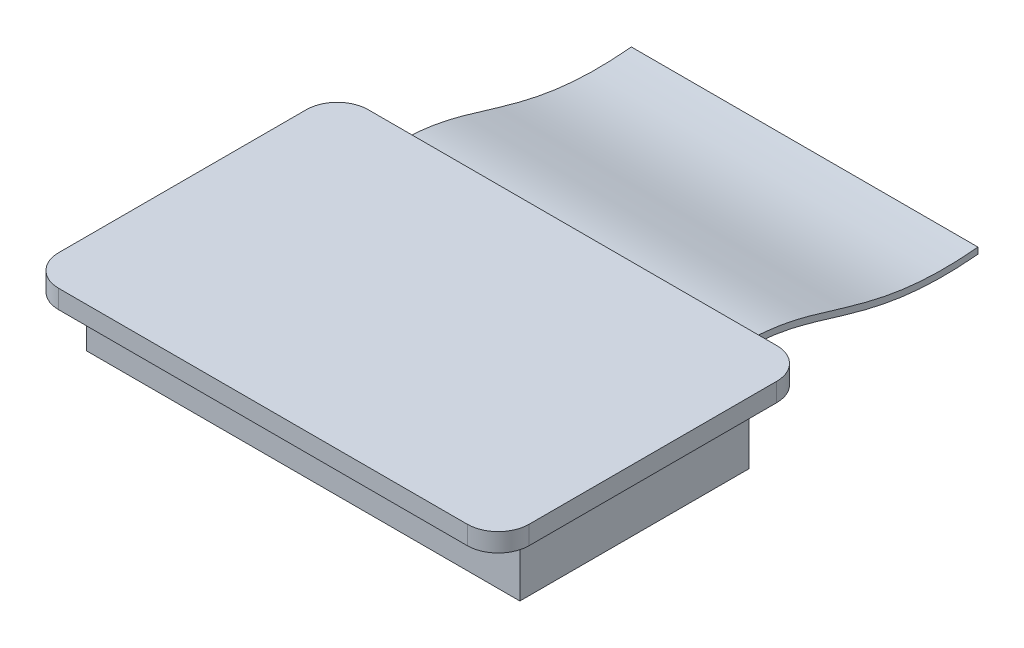
from build123d import *

# Parameters (mm, degrees)
F_3_8MM_FREE_LENGTH_START    = -2.8
F_3_8MM_FREE_LENGTH_DEPTH    = 5.6
PCB_DEPTH                    = 0.3
SKIZZE7_W                    = 3.7
SKIZZE7_H                    = 1
CONNECTOR_BOUNDARY_BOX_DEPTH = 3.5


# Read off the part's stored shape, not the designer's step: 3,8mm_free_Length
with BuildPart() as part:
    # 3,8mm_free_Length outline → 3,8mm_free_Length (new body)
    with BuildSketch(Plane.YZ.offset(F_3_8MM_FREE_LENGTH_START)):
        with BuildLine():
            add(Edge.make_bspline(
                [(0, 4), (-0.024628468, 4.256388466), (-0.038618016, 4.72259081), (0.01947153, 5.312011185), (0.129906645, 5.821389043), (0.291873769, 6.368027096), (0.477782991, 6.965975593), (0.547843022, 7.463268805), (0.547843022, 7.742133946)],
                knots=[0, 0, 0, 0, 0.14, 0.28, 0.42, 0.56, 0.78, 1, 1, 1, 1], degree=3))
            Line((0.547843022, 7.742133946), (0.448301222, 7.75169585))
            add(Edge.make_bspline(
                [(-0.1, 4), (-0.124487823, 4.260512861), (-0.138196079, 4.734963994), (-0.077568446, 5.337055167), (0.035994262, 5.856090972), (0.200282397, 6.407901627), (0.382793216, 6.999767267), (0.449818564, 7.4809073), (0.448301222, 7.75169585)],
                knots=[0, 0, 0, 0, 0.14, 0.28, 0.42, 0.56, 0.78, 1, 1, 1, 1], degree=3))
            Line((-0.1, 4), (0, 4))
        make_face()
    extrude(amount=F_3_8MM_FREE_LENGTH_DEPTH)


with BuildPart() as body_2:
    # Skizze6 → PCB (new body)
    with BuildSketch(Plane(origin=(0, 0.448301222, 0), x_dir=(-1, 0, 0), z_dir=(0, -1, 0))):
        with BuildLine():
            Line((3.3, -12.75169585), (-3.3, -12.75169585))
            ThreePointArc((-3.3, -12.75169585), (-3.653553391, -12.605249241), (-3.8, -12.25169585))
            Line((-3.8, -12.25169585), (-3.8, -8.25169585))
            ThreePointArc((-3.8, -8.25169585), (-3.653553391, -7.89814246), (-3.3, -7.75169585))
            Line((-3.3, -7.75169585), (3.3, -7.75169585))
            ThreePointArc((3.3, -7.75169585), (3.653553391, -7.89814246), (3.8, -8.25169585))
            Line((3.8, -8.25169585), (3.8, -12.25169585))
            ThreePointArc((3.8, -12.25169585), (3.653553391, -12.605249241), (3.3, -12.75169585))
        make_face()
    extrude(amount=-PCB_DEPTH)

    # Skizze7 → Connector_Boundary-Box (add, symmetric)
    with BuildSketch(Plane(origin=(0, 0, 0), x_dir=(0, 0, -1), z_dir=(1, 0, 0))):
        with Locations((-10.25169585, -0.051698778)):
            Rectangle(SKIZZE7_W, SKIZZE7_H)
    extrude(amount=CONNECTOR_BOUNDARY_BOX_DEPTH, both=True)


solid = Compound([part.part, body_2.part])
